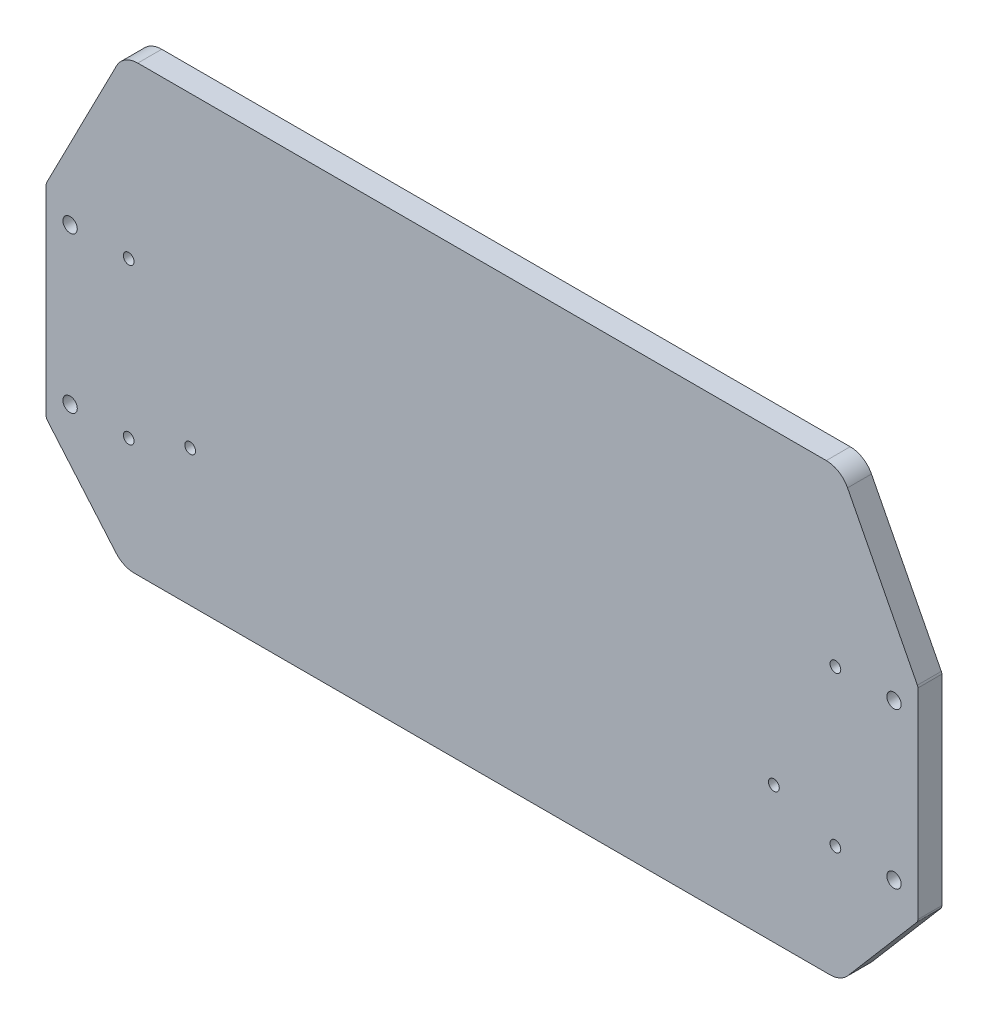
from build123d import *

# Parameters (mm, degrees)
BOSS_EXTRU_1_DEPTH      = 10
ESQUISSE3_R             = 2.25
ESQUISSE3_R_2           = 3
ENL_V_MAT_EXTRU_1_DEPTH = 10
ESQUISSE4_R             = 2.25
ENL_V_MAT_EXTRU_2_DEPTH = 10
CONG_1_R                = 10
CONG_2_R                = 2


with BuildPart() as part:
    # Esquisse1 → Boss.-Extru.1 (new body)
    with BuildSketch(Plane.XY):
        Polygon((-150, 105.2), (-182.2, 42.5), (-182.2, -42.5), (-150, -80.2), (150, -80.2), (182.2, -42.5), (182.2, 42.5), (150, 105.2), align=None)
    extrude(amount=BOSS_EXTRU_1_DEPTH)

    # Esquisse3 → Enlèv. mat.-Extru.1 (cut)
    with BuildSketch(Plane.XY.offset(10)):
        with Locations((-147.7, 32.5)):
            Circle(ESQUISSE3_R)
        with Locations((-172.2, 32.5)):
            Circle(ESQUISSE3_R_2)
        with Locations((-172.2, -32.5)):
            Circle(ESQUISSE3_R_2)
        with Locations((-147.7, -32.5)):
            Circle(ESQUISSE3_R)
        with Locations((172.2, -32.5)):
            Circle(ESQUISSE3_R_2)
        with Locations((147.7, -32.5)):
            Circle(ESQUISSE3_R)
        with Locations((172.2, 32.5)):
            Circle(ESQUISSE3_R_2)
        with Locations((147.7, 32.5)):
            Circle(ESQUISSE3_R)
    extrude(amount=-ENL_V_MAT_EXTRU_1_DEPTH, mode=Mode.SUBTRACT)

    # Esquisse4 → Enlèv. mat.-Extru.2 (cut)
    with BuildSketch(Plane.XY.offset(10)):
        with Locations((-122, -23.2)):
            Circle(ESQUISSE4_R)
        with Locations((122, -23.2)):
            Circle(ESQUISSE4_R)
    extrude(amount=-ENL_V_MAT_EXTRU_2_DEPTH, mode=Mode.SUBTRACT)

    # Congé1
    cong_1_edges = [part.edges().sort_by_distance(p)[0] for p in [
        (-150, 105.2, 5),
        (150, 105.2, 5),
        (150, -80.2, 5),
        (-150, -80.2, 5),
    ]]
    fillet(cong_1_edges, radius=CONG_1_R)

    # Congé2
    cong_2_edges = [part.edges().sort_by_distance(p)[0] for p in [
        (-182.2, -42.5, 5),
        (-182.2, 42.5, 5),
        (182.2, -42.5, 5),
        (182.2, 42.5, 5),
    ]]
    fillet(cong_2_edges, radius=CONG_2_R)


solid = part.part
